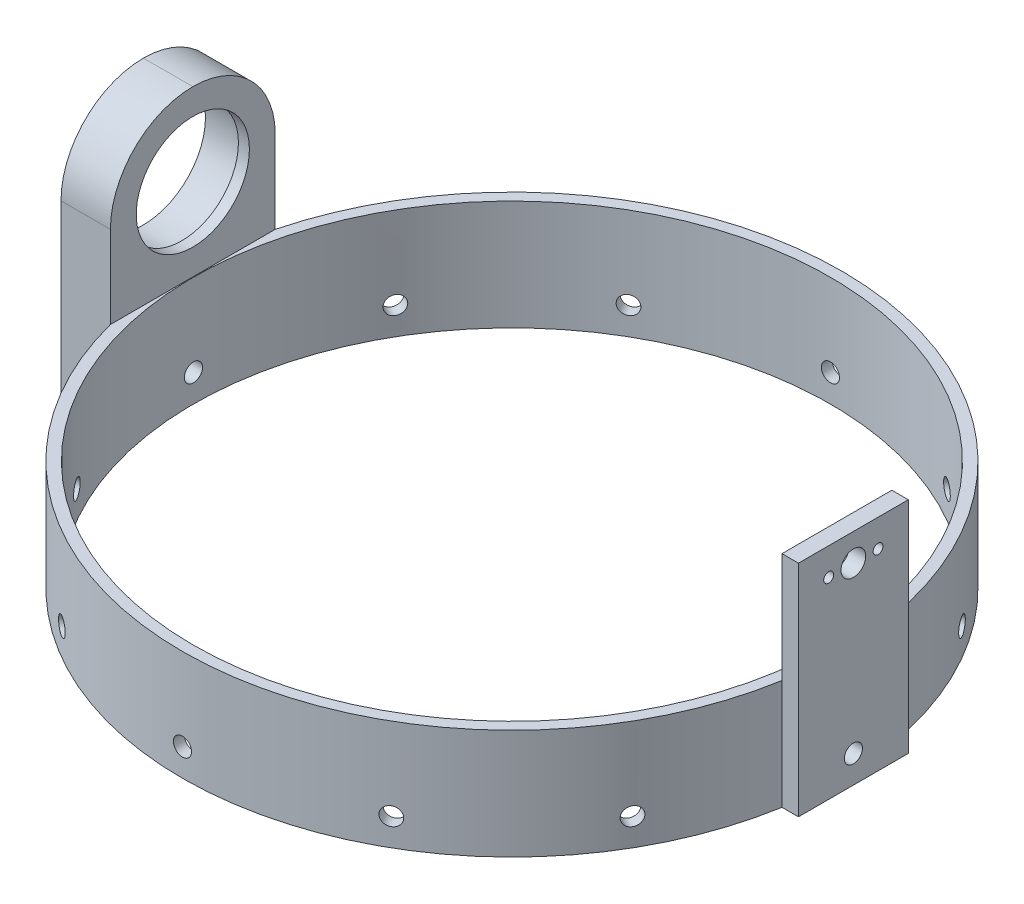
from build123d import *

# Parameters (mm, degrees)
SKETCH1_R                       = 60
SKETCH1_R_2                     = 58
BOSS_EXTRUDE1_DEPTH             = 20
SKETCH2_W                       = 3
SKETCH2_H                       = 20
BOSS_EXTRUDE2_DEPTH             = 20
BOSS_EXTRUDE2_DIRECTION_2_REACH = 89.178
SKETCH3_R                       = 2.25
SKETCH3_R_2                     = 0.9
CUT_EXTRUDE1_DEPTH              = 3
BOSS_EXTRUDE3_START             = -20
SKETCH4_W                       = 9
SKETCH4_H                       = 30
BOSS_EXTRUDE3_DEPTH             = 50
SKETCH5_R                       = 11.3
CUT_EXTRUDE2_DEPTH              = 144.39245737
SKETCH7_R                       = 11.3
SKETCH7_R_2                     = 10.3
BOSS_EXTRUDE4_DEPTH             = 2
FILLET1_R                       = 15
SKETCH8_R                       = 1.65
CUT_EXTRUDE3_DEPTH              = 103.964583734
CIRPATTERN1_COUNT               = 12


with BuildPart() as part:
    # Sketch1 → Boss-Extrude1 (new body)
    with BuildSketch(Plane(origin=(0, 0, 0), x_dir=(1, 0, 0), z_dir=(0, 1, 0))):
        with Locations(Location((0, 0, 0), (0, 0, 270))):
            Circle(SKETCH1_R)
        with Locations(Location((0, 0, 0), (0, 0, 270))):
            Circle(SKETCH1_R_2, mode=Mode.SUBTRACT)
    extrude(amount=BOSS_EXTRUDE1_DEPTH)

    # Sketch2 → Boss-Extrude2 (add)
    with BuildSketch(Plane(origin=(0, 20, 0), x_dir=(1, 0, 0), z_dir=(0, 1, 0))):
        with Locations((60.660797831, 0)):
            Rectangle(SKETCH2_W, SKETCH2_H)
    extrude(amount=BOSS_EXTRUDE2_DEPTH)

    # Boss-Extrude2 direction 2: up to this face of the body (flat: up to its plane)
    boss_extrude2_direction_2_end = Plane(part.part.faces().sort_by_distance((0, 0, -58.302943725))[0])
    # Sketch2 → Boss-Extrude2 direction 2 (add, up to the picked face)
    with BuildSketch(Plane(origin=(0, 20, 0), x_dir=(1, 0, 0), z_dir=(0, 1, 0)), mode=Mode.PRIVATE) as boss_extrude2_direction_2_sk1:
        with Locations((60.660797831, 0)):
            Rectangle(SKETCH2_W, SKETCH2_H)
    boss_extrude2_direction_2_tool1 = split(extrude(boss_extrude2_direction_2_sk1.sketch, amount=-BOSS_EXTRUDE2_DIRECTION_2_REACH, mode=Mode.PRIVATE), bisect_by=boss_extrude2_direction_2_end, keep=Keep.BOTH, mode=Mode.PRIVATE)
    add(boss_extrude2_direction_2_tool1.solids().sort_by(Axis((60.660798, 20, 0), (0, -1, 0)))[0])

    # Sketch3 → Cut-Extrude1 (cut)
    with BuildSketch(Plane.ZY.offset(-59.160797831)):
        with Locations((0, 35)):
            Circle(SKETCH3_R)
        with Locations((-4.5, 35)):
            Circle(SKETCH3_R_2)
        with Locations((4.5, 35)):
            Circle(SKETCH3_R_2)
    extrude(amount=-CUT_EXTRUDE1_DEPTH, mode=Mode.SUBTRACT)

    # Sketch4 → Boss-Extrude3 (add)
    with BuildSketch(Plane(origin=(0, 20, 0), x_dir=(1, 0, 0), z_dir=(0, 1, 0)).offset(BOSS_EXTRUDE3_START)):
        with Locations((-62.594750193, 0)):
            Rectangle(SKETCH4_W, SKETCH4_H)
    extrude(amount=BOSS_EXTRUDE3_DEPTH)

    # Sketch5 → Cut-Extrude2 (cut, through all)
    with BuildSketch(Plane(origin=(-58.094750193, 0, 0), x_dir=(0, 0, -1), z_dir=(1, 0, 0))):
        with Locations((0, 35)):
            Circle(SKETCH5_R)
    extrude(amount=-CUT_EXTRUDE2_DEPTH, mode=Mode.SUBTRACT)

    # Sketch7 → Boss-Extrude4 (add)
    with BuildSketch(Plane(origin=(-58.094750193, 0, 0), x_dir=(0, 0, -1), z_dir=(1, 0, 0))):
        with Locations((0, 35)):
            Circle(SKETCH7_R)
        with Locations((0, 35)):
            Circle(SKETCH7_R_2, mode=Mode.SUBTRACT)
    extrude(amount=-BOSS_EXTRUDE4_DEPTH)

    # Fillet1
    fillet1_edges = [part.edges().sort_by_distance(p)[0] for p in [
        (-62.594750193, 50, -15),
        (-62.594750193, 50, 15),
    ]]
    fillet(fillet1_edges, radius=FILLET1_R - 0.0001)  # a hair under: the kernel refuses the full size

    # Sketch8 → Cut-Extrude3 (cut, through all)
    with BuildSketch(Plane(origin=(0, 0, 0), x_dir=(0, 0, -1), z_dir=(1, 0, 0))):
        with Locations((0, 5)):
            Circle(SKETCH8_R)
    cut_extrude3 = extrude(amount=-CUT_EXTRUDE3_DEPTH, mode=Mode.SUBTRACT)

    # CirPattern1: Cut-Extrude3 ×12 about axis
    cirpattern1_axis = Axis((0, 20, 0), (0, -1, 0))
    for i in range(1, CIRPATTERN1_COUNT):
        add(cut_extrude3.rotate(cirpattern1_axis, i * 360 / CIRPATTERN1_COUNT), mode=Mode.SUBTRACT)


solid = part.part
